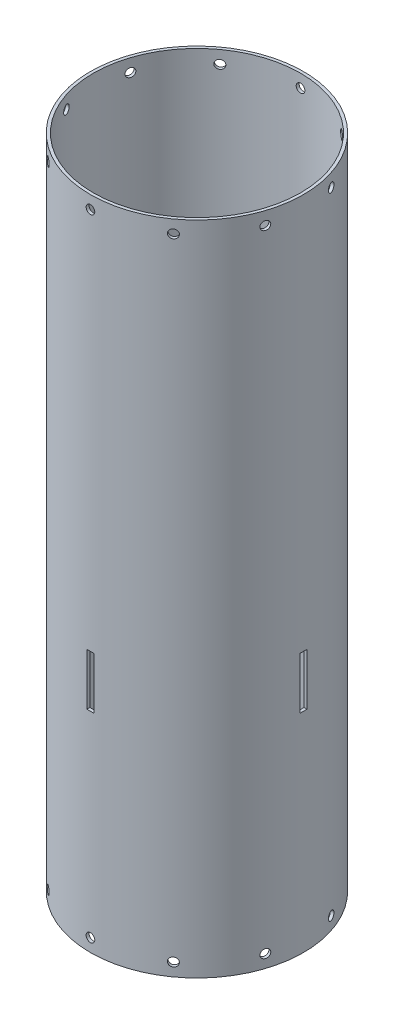
from build123d import *

# Parameters (mm, degrees)
SKETCH1_R           = 78.359
SKETCH1_R_2         = 76.2
BOSS_EXTRUDE1_DEPTH = 482.6
SKETCH2_R           = 3.175
CUT_EXTRUDE1_DEPTH  = 496.159596254
CIRPATTERN1_COUNT   = 10
SKETCH3_W           = 5.08
SKETCH3_H           = 38.1
CUT_EXTRUDE2_DEPTH  = 496.159596383
CIRPATTERN2_COUNT   = 4


with BuildPart() as part:
    # Sketch1 → Boss-Extrude1 (new body)
    with BuildSketch(Plane(origin=(0, 0, 0), x_dir=(1, 0, 0), z_dir=(0, 1, 0))):
        Circle(SKETCH1_R)
        Circle(SKETCH1_R_2, mode=Mode.SUBTRACT)
    extrude(amount=BOSS_EXTRUDE1_DEPTH)

    # Sketch2 → Cut-Extrude1 (cut, through all)
    with BuildSketch(Plane.XY):
        with Locations((0, 9.525)):
            Circle(SKETCH2_R)
        with Locations((0, 473.075)):
            Circle(SKETCH2_R)
    cut_extrude1 = extrude(amount=-CUT_EXTRUDE1_DEPTH, mode=Mode.SUBTRACT)

    # CirPattern1: Cut-Extrude1 ×10 about axis
    cirpattern1_axis = Axis((0, 0, 0), (0, 1, 0))
    for i in range(1, CIRPATTERN1_COUNT):
        add(cut_extrude1.rotate(cirpattern1_axis, i * 360 / CIRPATTERN1_COUNT), mode=Mode.SUBTRACT)

    # Sketch3 → Cut-Extrude2 (cut, through all)
    with BuildSketch(Plane.XY):
        with Locations((0, 172.72)):
            Rectangle(SKETCH3_W, SKETCH3_H)
    cut_extrude2 = extrude(amount=-CUT_EXTRUDE2_DEPTH, mode=Mode.SUBTRACT)

    # CirPattern2: Cut-Extrude2 ×4 about axis
    cirpattern2_axis = Axis((0, 482.6, 0), (0, -1, 0))
    for i in range(1, CIRPATTERN2_COUNT):
        add(cut_extrude2.rotate(cirpattern2_axis, i * 360 / CIRPATTERN2_COUNT), mode=Mode.SUBTRACT)


solid = part.part
